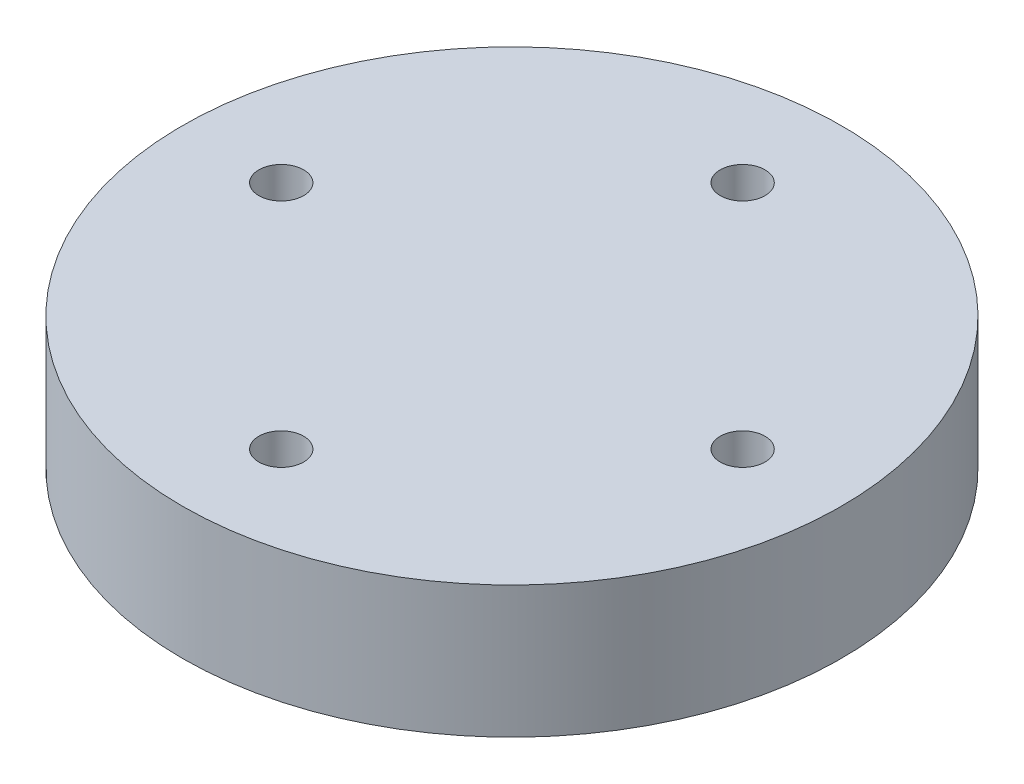
from build123d import *

# Parameters (mm, degrees)
SKIZZE1_R                       = 25
AUFSATZ_LINEAR_AUSTRAGEN1_DEPTH = 10
SKIZZE2_R                       = 13
SKIZZE2_R_2                     = 11
AUFSATZ_LINEAR_AUSTRAGEN2_DEPTH = 2
SCHNITT_LINEAR_START            = 8
SKIZZE3_R                       = 11
SCHNITT_LINEAR_AUSTRAGEN1_DEPTH = 8
FASE1_SIZE                      = 1
SKIZZE4_R                       = 1.7
SCHNITT_LINEAR_AUSTRAGEN2_DEPTH = 37.742346142
KREISMUSTER1_COUNT              = 4


with BuildPart() as part:
    # Skizze1 → Aufsatz-Linear austragen1 (new body)
    with BuildSketch(Plane(origin=(0, 0, 0), x_dir=(1, 0, 0), z_dir=(0, 1, 0))):
        Circle(SKIZZE1_R)
    extrude(amount=AUFSATZ_LINEAR_AUSTRAGEN1_DEPTH)

    # Skizze2 → Aufsatz-Linear austragen2 (add)
    with BuildSketch(Plane.XZ):
        Circle(SKIZZE2_R)
        Circle(SKIZZE2_R_2, mode=Mode.SUBTRACT)
    extrude(amount=AUFSATZ_LINEAR_AUSTRAGEN2_DEPTH)

    # Skizze3 → Schnitt-Linear austragen1 (cut)
    with BuildSketch(Plane(origin=(0, 0, 0), x_dir=(1, 0, 0), z_dir=(0, 1, 0)).offset(SCHNITT_LINEAR_START)):
        Circle(SKIZZE3_R)
    extrude(amount=-SCHNITT_LINEAR_AUSTRAGEN1_DEPTH, mode=Mode.SUBTRACT)

    # Fase1
    fase1_edges = [part.edges().sort_by_distance(p)[0] for p in [
        (-13, -2, 0),
    ]]
    chamfer(fase1_edges, length=FASE1_SIZE)

    # Skizze4 → Schnitt-Linear austragen2 (cut, through all)
    with BuildSketch(Plane.XZ):
        with Locations((0, 17.5)):
            Circle(SKIZZE4_R)
    schnitt_linear_austragen2 = extrude(amount=-SCHNITT_LINEAR_AUSTRAGEN2_DEPTH, mode=Mode.SUBTRACT)

    # Kreismuster1: Schnitt-Linear austragen2 ×4 about axis
    kreismuster1_axis = Axis((0, 10, 0), (0, -1, 0))
    for i in range(1, KREISMUSTER1_COUNT):
        add(schnitt_linear_austragen2.rotate(kreismuster1_axis, i * 360 / KREISMUSTER1_COUNT), mode=Mode.SUBTRACT)


solid = part.part
